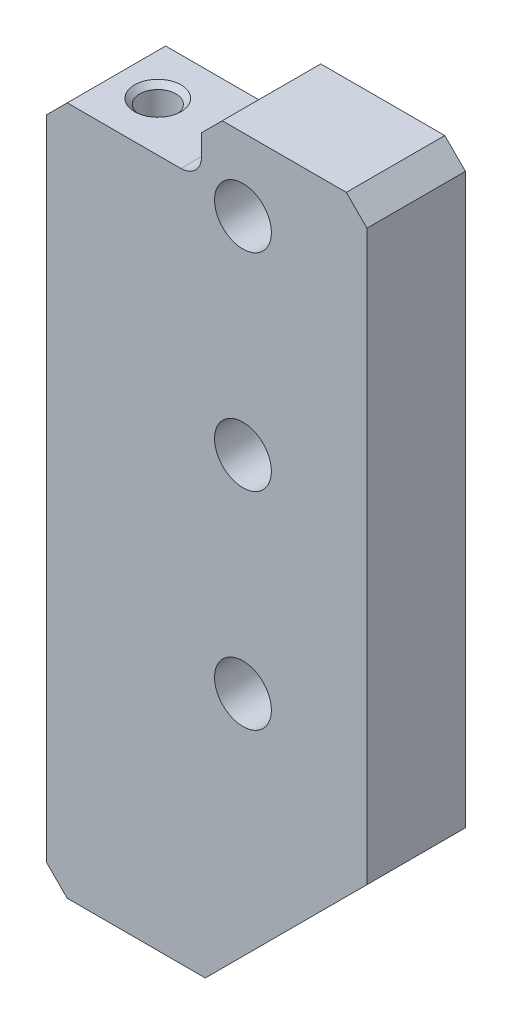
from build123d import *

# Parameters (mm, degrees)
BOSS_EXTRUDE1_DEPTH      = 4.7625
BOSS_EXTRUDE1_DEPTH_BACK = 4.7625
SKETCH1_R                = 2.75
CHAMFER1_SIZE            = 2
CHAMFER2_SIZE            = 0.5
FILLET1_R                = 2


with BuildPart() as part:
    # Sketch1 → Boss-Extrude1 (new, two sides: drawn at the far end of the back side and taken through both)
    with BuildSketch(Plane.XY.offset(-BOSS_EXTRUDE1_DEPTH_BACK)):
        Polygon((-160.887770797, 18.552308679), (-176.247691321, 18.552308679), (-176.247691321, 85.192388155), (-161.247691321, 85.192388155), (-161.247691321, 91.192388155), (-145.247691321, 91.192388155), (-145.247691321, 34.192388155), align=None)
        with Locations((-157.247691321, 44.192388155)):
            Circle(SKETCH1_R, mode=Mode.SUBTRACT)
        with Locations((-157.247691321, 64.192388155)):
            Circle(SKETCH1_R, mode=Mode.SUBTRACT)
        with Locations((-157.247691321, 84.192388155)):
            Circle(SKETCH1_R, mode=Mode.SUBTRACT)
    extrude(amount=BOSS_EXTRUDE1_DEPTH + BOSS_EXTRUDE1_DEPTH_BACK)

    # Sketch2 → Cut-Revolve1 (revolve, cut)
    with BuildSketch(Plane.XY):
        Polygon((-170.247691321, 85.192388155), (-171.997691321, 85.192388155), (-171.997691321, 80.192388155), (-171.447691321, 79.874845507), (-171.447691321, 65.019183075), (-170.247691321, 64.326362752), align=None)
    revolve(axis=Axis((-170.247691321, 85.192388155, 0), (0, 1, 0)), mode=Mode.SUBTRACT)

    # Chamfer1
    chamfer1_edges = [part.edges().sort_by_distance(p)[0] for p in [
        (-176.247691321, 18.552308679, 0),
        (-145.247691321, 91.192388155, 0),
        (-161.247691321, 91.192388155, 0),
        (-176.247691321, 85.192388155, 0),
    ]]
    chamfer(chamfer1_edges, length=CHAMFER1_SIZE)

    # Chamfer2
    chamfer2_edges = [part.edges().sort_by_distance(p)[0] for p in [
        (-168.497691321, 85.192388155, 0),
    ]]
    chamfer(chamfer2_edges, length=CHAMFER2_SIZE)

    # Fillet1
    fillet1_edges = [part.edges().sort_by_distance(p)[0] for p in [
        (-161.247691321, 85.192388155, 0),
    ]]
    fillet(fillet1_edges, radius=FILLET1_R)


solid = part.part
